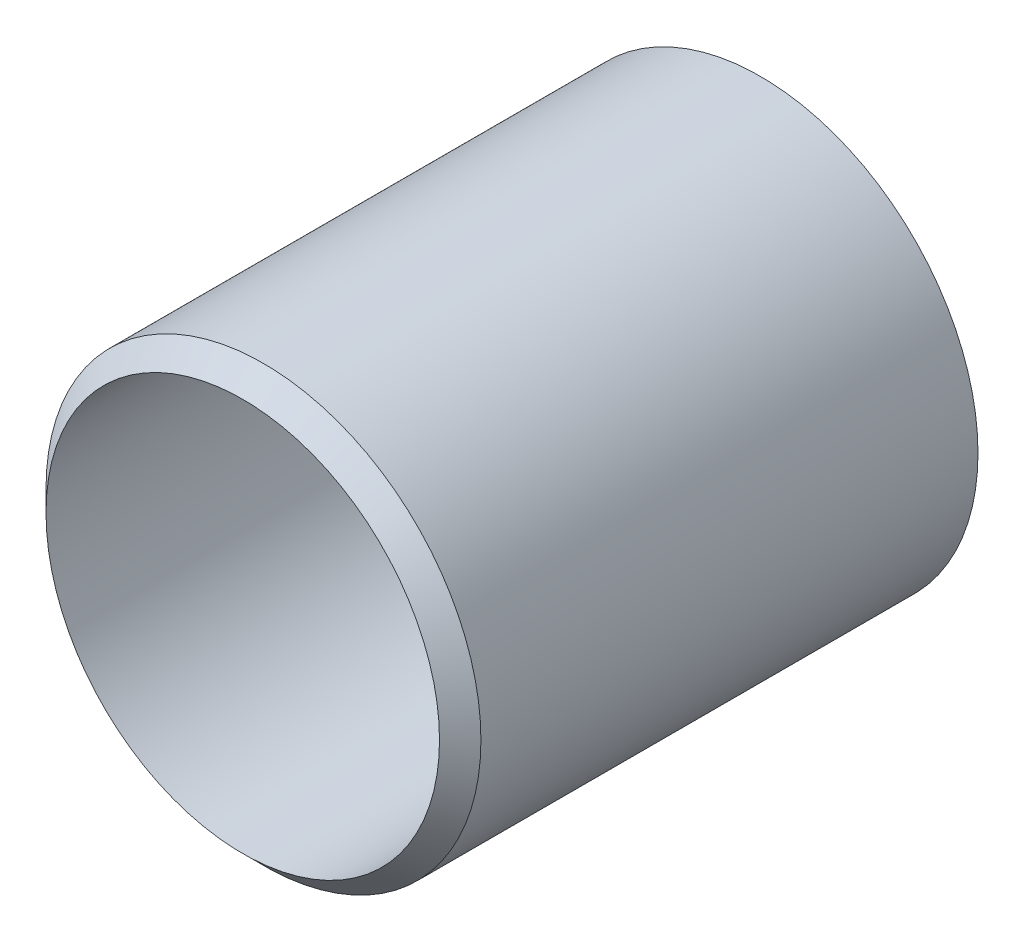
from build123d import *

# Parameters (mm, degrees)
ESQUISSE1_R        = 31.5
ESQUISSE1_R_2      = 28.5
BOSS_EXTRU_1_DEPTH = 76
CHANFREIN1_SIZE    = 4


with BuildPart() as part:
    # Esquisse1 → Boss.-Extru.1 (new body)
    with BuildSketch(Plane.XY):
        Circle(ESQUISSE1_R)
        Circle(ESQUISSE1_R_2, mode=Mode.SUBTRACT)
    extrude(amount=BOSS_EXTRU_1_DEPTH)

    # Chanfrein1
    # the kernel refuses this chamfer: 4 mm, written as the material it takes off along each edge
    with BuildSketch(Plane(origin=(0, 0, 76), x_dir=(1, 0, 0), z_dir=(0, -1, 0))) as chanfrein1_piece_1:
        Polygon((31.5, -CHANFREIN1_SIZE), (31.5 - CHANFREIN1_SIZE, 0), (31.5, 0), align=None)
    revolve(axis=Axis((0, 0, 76), (0, 0, 1)), mode=Mode.SUBTRACT)


solid = part.part
